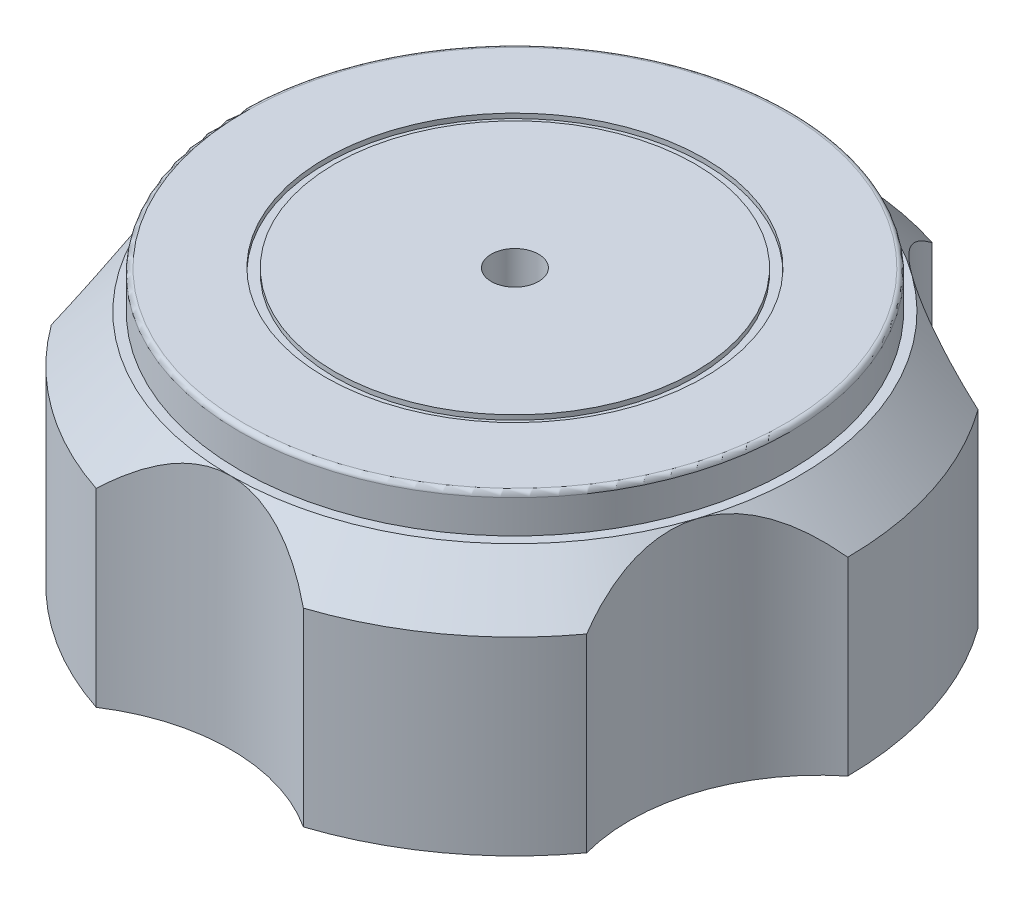
from build123d import *

# Parameters (mm, degrees)
BOSS_EXTRUDE2_DEPTH = 25
FILLET6_SIZE        = 5
SKETCH4_R           = 25
SKETCH4_R_2         = 5
CUT_EXTRUDE1_DEPTH  = 20
SKETCH4_3_R         = 2.6
CUT_EXTRUDE2_DEPTH  = 20
THREAD1_PITCH       = 1.5
THREAD1_FROM        = 1.5
SKETCH7_R           = 29
BOSS_EXTRUDE4_DEPTH = 4
SKETCH8_R           = 20
SKETCH8_R_2         = 19
CUT_EXTRUDE3_DEPTH  = 0.5
FILLET7_R           = 0.5
SKETCH9_R           = 2.5
CUT_EXTRUDE4_DEPTH  = 10


with BuildPart() as part:
    # Sketch1 → Boss-Extrude2 (new body)
    with BuildSketch(Plane(origin=(0, 0, 0), x_dir=(1, 0, 0), z_dir=(0, 1, 0))):
        with BuildLine():
            ThreePointArc((28.245460772, -20.668670634), (28.531695489, -9.270509831), (34.999797562, 0.119040508))
            ThreePointArc((34.999797562, 0.119040508), (33.28697807, 10.815594803), (28.385401282, 20.476059046))
            ThreePointArc((28.385401282, 20.476059046), (17.633557569, 24.270509831), (10.702317995, 33.32357108))
            ThreePointArc((10.702317995, 33.32357108), (0, 35), (-10.702317995, 33.32357108))
            ThreePointArc((-10.702317995, 33.32357108), (-17.633557569, 24.270509831), (-28.385401282, 20.476059046))
            ThreePointArc((-28.385401282, 20.476059046), (-33.28697807, 10.815594803), (-34.999797562, 0.119040508))
            ThreePointArc((-34.999797562, 0.119040508), (-29.510368041, -6.821265866), (-27.552825815, -15.450849719))
            ThreePointArc((-27.552825815, -15.450849719), (-27.726740714, -18.082645602), (-28.245460772, -20.668670634))
            ThreePointArc((-28.245460772, -20.668670634), (-20.57248383, -28.315594803), (-10.928746497, -33.25))
            ThreePointArc((-10.928746497, -33.25), (0, -30), (10.928746497, -33.25))
            ThreePointArc((10.928746497, -33.25), (20.57248383, -28.315594803), (28.245460772, -20.668670634))
        make_face()
    extrude(amount=BOSS_EXTRUDE2_DEPTH)

    # Fillet6
    fillet6_edges = [part.edges().sort_by_distance(p)[0] for p in [
        (-33.28697807, 25, -10.815594803),
        (0, 25, -35),
        (33.28697807, 25, -10.815594803),
        (20.57248383, 25, 28.315594803),
        (-20.57248383, 25, 28.315594803),
    ]]
    chamfer(fillet6_edges, length=FILLET6_SIZE - 0.0001)  # a hair under: the kernel refuses the full size

    # Sketch4 → Cut-Extrude1 (cut)
    with BuildSketch(Plane(origin=(0, 0, 0), x_dir=(-1, 0, 0), z_dir=(0, -1, 0))):
        with Locations(Location((0, 0, 0), (0, 0, 90))):
            Circle(SKETCH4_R)
        with Locations(Location((0, 0, 0), (0, 0, 90))):
            Circle(SKETCH4_R_2, mode=Mode.SUBTRACT)
    extrude(amount=-CUT_EXTRUDE1_DEPTH, mode=Mode.SUBTRACT)

    # Sketch4<3> → Cut-Extrude2 (cut)
    with BuildSketch(Plane(origin=(0, 0, 0), x_dir=(-1, 0, 0), z_dir=(0, -1, 0))):
        with Locations(Location((0, 0, 0), (0, 0, 90))):
            Circle(SKETCH4_3_R)
    extrude(amount=-CUT_EXTRUDE2_DEPTH, mode=Mode.SUBTRACT)

    # Thread1: arcs per turn and ends read off the stored shape
    # Thread1: the profile of Thread Profile1 profile screwed along a right-hand helix through 14.333333 turns, 8 arcs to a turn; built about Z, then put on its axis
    thread1_z = Axis((0, 0, 0), (0, 0, 1))
    thread1_corners = [(25.0003, 0, -0.000173205), (25.0003, 0, 1.312673201), (24.188101187, 0, 0.843749998), (24.188101187, 0, 0.468749998)]
    with BuildLine(mode=Mode.PRIVATE) as thread1_profile:
        Line(thread1_corners[0], thread1_corners[1])
        Line(thread1_corners[1], thread1_corners[2])
        Line(thread1_corners[2], thread1_corners[3])
        Line(thread1_corners[3], thread1_corners[0])
    thread1_cap = Face(thread1_profile.wire())
    thread1_turn_angles = [0, 22.5, 45, 67.5, 90, 112.5, 135, 157.5, 180, 202.5, 225, 247.5, 270, 292.5, 315, 337.5, 360]
    thread1_turn_weights = [1, 0.9238795325112867, 1, 0.9238795325112867, 1, 0.9238795325112867, 1, 0.9238795325112867, 1, 0.9238795325112867, 1, 0.9238795325112867, 1, 0.9238795325112867, 1, 0.9238795325112867, 1]
    thread1_turn_rails = [Edge.make_bspline([Vector(p[0], p[1], 0).rotate(thread1_z, thread1_turn_angles[k]) / thread1_turn_weights[k] + Vector(0, 0, p[2] + THREAD1_PITCH * thread1_turn_angles[k] / 360) for k in range(17)], [0, 0, 0, 1, 1, 2, 2, 3, 3, 4, 4, 5, 5, 6, 6, 7, 7, 8, 8, 8], 2, thread1_turn_weights) for p in thread1_corners]
    thread1_turn_sides = [Face.make_surface_from_curves(thread1_turn_rails[p[0]], thread1_turn_rails[p[1]]) for p in [(0, 1), (1, 2), (2, 3), (3, 0)]]
    thread1_last_angles = [5040, 5062.5, 5085, 5107.5, 5130, 5145, 5160]
    thread1_last_weights = [1, 0.9238795325112867, 1, 0.9238795325112867, 1, 0.9659258262890703, 1]
    thread1_last_rails = [Edge.make_bspline([Vector(p[0], p[1], 0).rotate(thread1_z, thread1_last_angles[k]) / thread1_last_weights[k] + Vector(0, 0, p[2] + THREAD1_PITCH * thread1_last_angles[k] / 360) for k in range(7)], [0, 0, 0, 1, 1, 2, 2, 3, 3, 3], 2, thread1_last_weights) for p in thread1_corners]
    thread1_last_sides = [Face.make_surface_from_curves(thread1_last_rails[p[0]], thread1_last_rails[p[1]]) for p in [(0, 1), (1, 2), (2, 3), (3, 0)]]
    thread1 = Plane(origin=(0, -1.5, 0), x_dir=(1, 0, 0), z_dir=(0, 1, 0)) * split(Solid(Shell([*[p.moved(Location((0, 0, THREAD1_PITCH * i))) for i in range(14) for p in thread1_turn_sides], *thread1_last_sides, thread1_cap, thread1_cap.rotate(thread1_z, 5160).moved(Location((0, 0, THREAD1_PITCH * 5160 / 360)))])), bisect_by=Plane.XY.offset(THREAD1_FROM), keep=Keep.TOP, mode=Mode.PRIVATE)
    add(thread1)

    # Sketch7 → Boss-Extrude4 (add)
    with BuildSketch(Plane(origin=(0, 25, 0), x_dir=(1, 0, 0), z_dir=(0, 1, 0))):
        with Locations(Location((0, 0, 0), (0, 0, 270))):
            Circle(SKETCH7_R)
    extrude(amount=BOSS_EXTRUDE4_DEPTH)

    # Sketch8 → Cut-Extrude3 (cut)
    with BuildSketch(Plane(origin=(0, 29, 0), x_dir=(1, 0, 0), z_dir=(0, 1, 0))):
        with Locations(Location((0, 0, 0), (0, 0, 270))):
            Circle(SKETCH8_R)
        with Locations(Location((0, 0, 0), (0, 0, 270))):
            Circle(SKETCH8_R_2, mode=Mode.SUBTRACT)
    extrude(amount=-CUT_EXTRUDE3_DEPTH, mode=Mode.SUBTRACT)

    # Fillet7
    fillet7_edges = [part.edges().sort_by_distance(p)[0] for p in [
        (0, 29, -29),
    ]]
    fillet(fillet7_edges, radius=FILLET7_R)

    # Sketch9 → Cut-Extrude4 (cut)
    with BuildSketch(Plane(origin=(0, 29, 0), x_dir=(1, 0, 0), z_dir=(0, 1, 0))):
        with Locations(Location((0, 0, 0), (0, 0, 270))):
            Circle(SKETCH9_R)
    extrude(amount=-CUT_EXTRUDE4_DEPTH, mode=Mode.SUBTRACT)


solid = part.part
